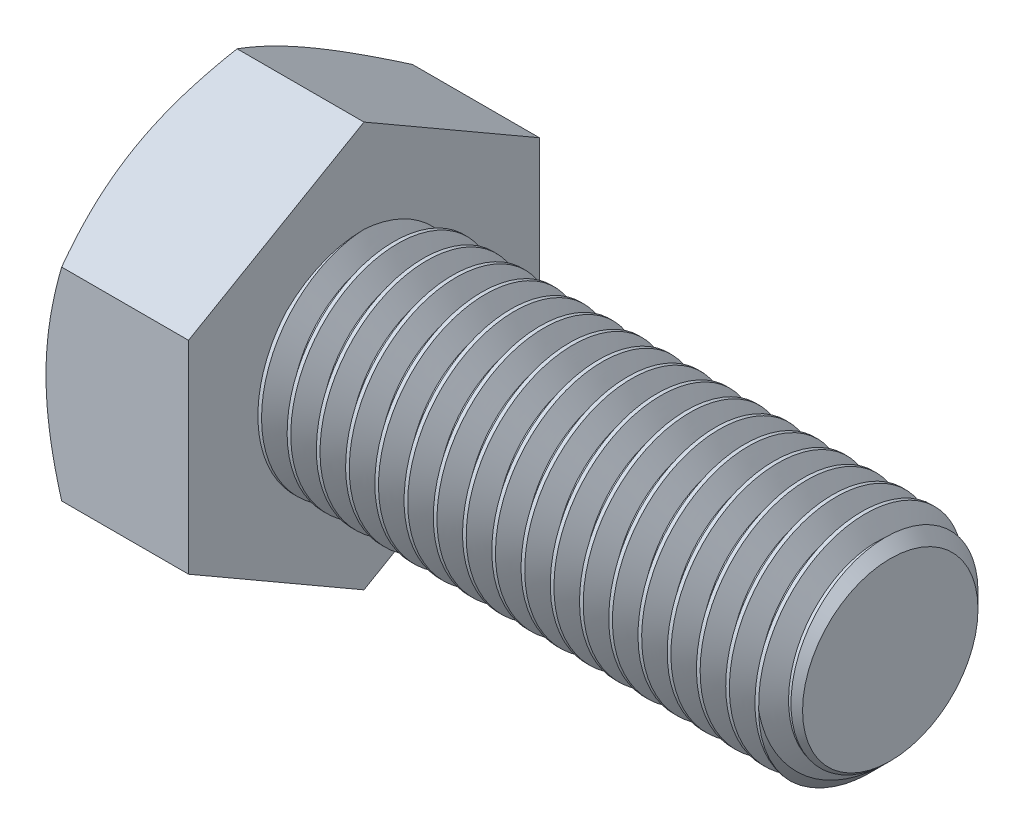
from build123d import *

# Parameters (mm, degrees)
SKETCH5_R           = 3.96875
BOSS_EXTRUDE3_DEPTH = 19.05
CHAMFER1_SIZE       = 0.79375
CUT_SWEEP1_PITCH    = 1.058333333
BOSS_EXTRUDE4_DEPTH = 5.159375
SKETCH8_OUTSIDE_W   = 114.714
SKETCH8_OUTSIDE_H   = 116.678
SKETCH8_OUTSIDE_R   = 6.35
CUT_EXTRUDE3_DEPTH  = 27.080254577
CUT_EXTRUDE3_DRAFT  = -60


with BuildPart() as part:
    # Sketch5 → Boss-Extrude3 (new body)
    with BuildSketch(Plane(origin=(12.1046875, 0, 0), x_dir=(0, 0, -1), z_dir=(1, 0, 0))):
        Circle(SKETCH5_R)
    extrude(amount=-BOSS_EXTRUDE3_DEPTH)

    # Chamfer1
    chamfer1_edges = [part.edges().sort_by_distance(p)[0] for p in [
        (12.1046875, 0, 3.96875),
    ]]
    chamfer(chamfer1_edges, length=CHAMFER1_SIZE)

    # Cut-Sweep1: the profile of Sketch10 profile screwed along a right-hand helix of 19 turns, 8 arcs to a turn; built about Z, then put on its axis
    cut_sweep1_z = Axis((0, 0, 0), (0, 0, 1))
    cut_sweep1_corners = [(3.96905, 0, 0.000173205), (3.281342336, 0, -0.396875), (3.281342336, 0, -0.529166667), (3.96905, 0, -0.926214872)]
    with BuildLine(mode=Mode.PRIVATE) as cut_sweep1_profile:
        Line(cut_sweep1_corners[0], cut_sweep1_corners[1])
        Line(cut_sweep1_corners[1], cut_sweep1_corners[2])
        Line(cut_sweep1_corners[2], cut_sweep1_corners[3])
        Line(cut_sweep1_corners[3], cut_sweep1_corners[0])
    cut_sweep1_cap = Face(cut_sweep1_profile.wire())
    cut_sweep1_turn_angles = [0, 22.5, 45, 67.5, 90, 112.5, 135, 157.5, 180, 202.5, 225, 247.5, 270, 292.5, 315, 337.5, 360]
    cut_sweep1_turn_weights = [1, 0.9238795325112867, 1, 0.9238795325112867, 1, 0.9238795325112867, 1, 0.9238795325112867, 1, 0.9238795325112867, 1, 0.9238795325112867, 1, 0.9238795325112867, 1, 0.9238795325112867, 1]
    cut_sweep1_turn_rails = [Edge.make_bspline([Vector(p[0], p[1], 0).rotate(cut_sweep1_z, cut_sweep1_turn_angles[k]) / cut_sweep1_turn_weights[k] + Vector(0, 0, p[2] + CUT_SWEEP1_PITCH * cut_sweep1_turn_angles[k] / 360) for k in range(17)], [0, 0, 0, 1, 1, 2, 2, 3, 3, 4, 4, 5, 5, 6, 6, 7, 7, 8, 8, 8], 2, cut_sweep1_turn_weights) for p in cut_sweep1_corners]
    cut_sweep1_turn_sides = [Face.make_surface_from_curves(cut_sweep1_turn_rails[p[0]], cut_sweep1_turn_rails[p[1]]) for p in [(0, 1), (1, 2), (2, 3), (3, 0)]]
    cut_sweep1 = Plane(origin=(12.1046875, 0, 0), x_dir=(0, 1, 0), z_dir=(-1, 0, 0)) * Solid(Shell([*[p.moved(Location((0, 0, CUT_SWEEP1_PITCH * i))) for i in range(19) for p in cut_sweep1_turn_sides], cut_sweep1_cap, cut_sweep1_cap.rotate(cut_sweep1_z, 6840).moved(Location((0, 0, CUT_SWEEP1_PITCH * 6840 / 360)))]))
    add(cut_sweep1, mode=Mode.SUBTRACT)

    # Sketch6 → Boss-Extrude4 (add)
    with BuildSketch(Plane.ZY.offset(6.9453125)):
        Polygon((6.35, 3.666174209), (0, 7.332348419), (-6.35, 3.666174209), (-6.35, -3.666174209), (0, -7.332348419), (6.35, -3.666174209), align=None)
    extrude(amount=BOSS_EXTRUDE4_DEPTH)


with BuildPart() as cut_extrude3_tool:
    # Sketch8 outside → Cut-Extrude3 (with draft: the straight prism first)
    with BuildSketch(Plane.ZY.offset(12.1046875)):
        Rectangle(SKETCH8_OUTSIDE_W, SKETCH8_OUTSIDE_H)
        Circle(SKETCH8_OUTSIDE_R, mode=Mode.SUBTRACT)
    extrude(amount=-CUT_EXTRUDE3_DEPTH)
    # Cut-Extrude3: the draft: its side faces are tilted about the plane it starts from
    cut_extrude3_sides = [cut_extrude3_tool.faces().sort_by_distance(p)[0] for p in [
        (1.435439789, -58.339, 0),
        (1.435439789, 0, 57.357),
        (1.435439789, 58.339, 0),
        (1.435439789, 0, -57.357),
        (1.435439789, 0, -6.35),
    ]]
    draft(cut_extrude3_sides, Plane.ZY.offset(12.1046875), CUT_EXTRUDE3_DRAFT)


with BuildPart() as part_1:
    add(part.part)

    # Cut-Extrude3: cut by cut_extrude3_tool
    add(cut_extrude3_tool.part, mode=Mode.SUBTRACT)


solid = part_1.part
